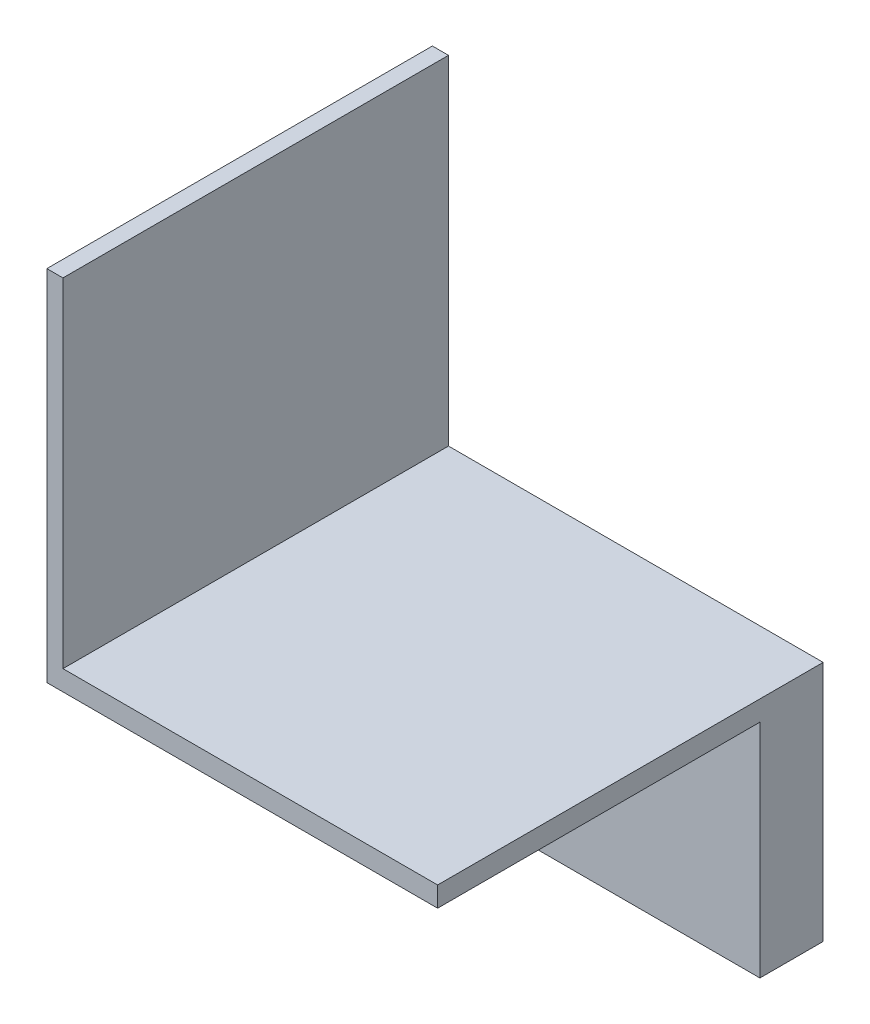
from build123d import *

# Parameters (mm, degrees)
SKETCH1_W           = 45.5
SKETCH1_H           = 27
BOSS_EXTRUDE1_DEPTH = 7.85
SKETCH3_W           = 48.5
SKETCH3_H           = 7.85
BOSS_EXTRUDE2_DEPTH = 3
SKETCH4_W           = 48.5
SKETCH4_H           = 2.5
BOSS_EXTRUDE3_DEPTH = 40
SKETCH5_W           = 2
SKETCH5_H           = 47.85
BOSS_EXTRUDE4_DEPTH = 42


with BuildPart() as part:
    # Sketch1 → Boss-Extrude1 (new body)
    with BuildSketch(Plane.XY):
        with Locations((22.75, 13.5)):
            Rectangle(SKETCH1_W, SKETCH1_H)
    extrude(amount=BOSS_EXTRUDE1_DEPTH)

    # Sketch3 → Boss-Extrude2 (add)
    with BuildSketch(Plane(origin=(0, 27, 0), x_dir=(1, 0, 0), z_dir=(0, 1, 0))):
        with Locations((21.25, -3.925)):
            Rectangle(SKETCH3_W, SKETCH3_H)
    extrude(amount=BOSS_EXTRUDE2_DEPTH)

    # Sketch4 → Boss-Extrude3 (add)
    with BuildSketch(Plane.XY.offset(7.85)):
        with Locations((21.25, 28.75)):
            Rectangle(SKETCH4_W, SKETCH4_H)
    extrude(amount=BOSS_EXTRUDE3_DEPTH)

    # Sketch5 → Boss-Extrude4 (add)
    with BuildSketch(Plane(origin=(0, 30, 0), x_dir=(1, 0, 0), z_dir=(0, 1, 0))):
        with Locations((-2, -23.925)):
            Rectangle(SKETCH5_W, SKETCH5_H)
    extrude(amount=BOSS_EXTRUDE4_DEPTH)


solid = part.part
